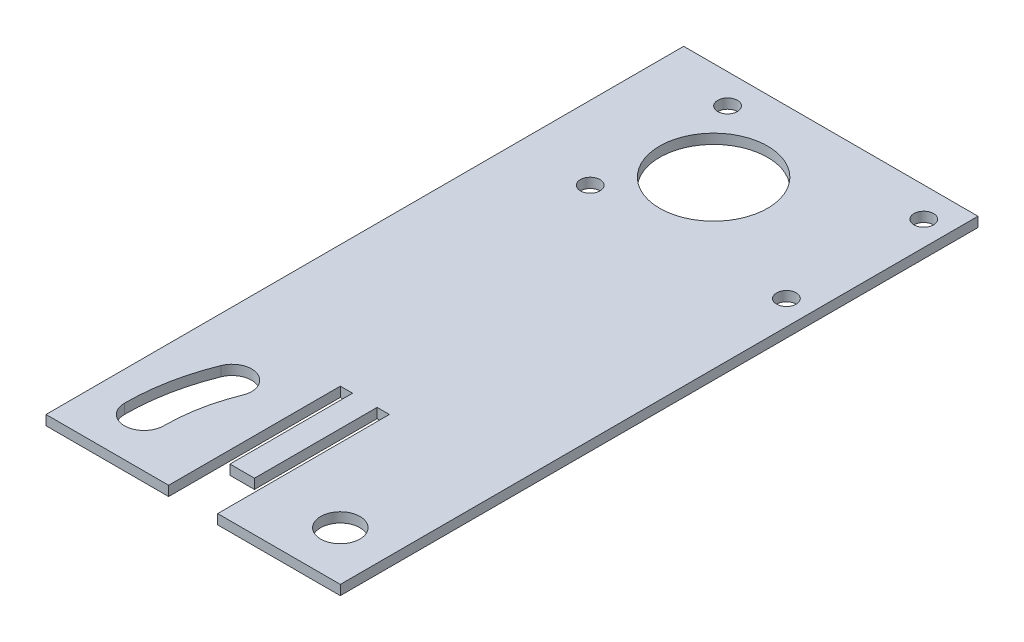
from build123d import *

# Parameters (mm, degrees)
BRIDA_START           = -2
BRIDA_BASE1_OUTLINE_R = 4
BRIDA_BASE1_DEPTH     = 2
CROQUIS6_R            = 2
CROQUIS6_R_2          = 11
CORTAR_EXTRUIR1_DEPTH = 10


# Read off the part's stored shape, not the designer's step: Brida base1
with BuildPart() as part:
    # Brida base1 outline → Brida base1 (new body)
    with BuildSketch(Plane(origin=(0, 0, 0), x_dir=(1, 0, 0), z_dir=(0, 1, 0)).offset(BRIDA_START)):
        Polygon((5, 35), (5, 0), (30, 0), (30, 130), (-30, 130), (-30, 0), (-5, 0), (-5, 35), (-2.5, 35), (-2.5, 10), (2.5, 10), (2.5, 35), align=None)
        with BuildLine():
            ThreePointArc((-24, 10), (-23.18981381, 18.404759548), (-20.789091679, 26.5))
            ThreePointArc((-20.789091679, 26.5), (-15.580992435, 28.708099244), (-13.372893192, 23.5))
            ThreePointArc((-13.372893192, 23.5), (-15.33712039, 16.876621448), (-16, 10))
            ThreePointArc((-16, 10), (-20, 6), (-24, 10))
        make_face(mode=Mode.SUBTRACT)
        with Locations((20, 10)):
            Circle(BRIDA_BASE1_OUTLINE_R, mode=Mode.SUBTRACT)
    extrude(amount=BRIDA_BASE1_DEPTH)

    # Croquis6 → Cortar-Extruir1 (cut)
    with BuildSketch(Plane(origin=(0, 0, 0), x_dir=(1, 0, 0), z_dir=(0, 1, 0))):
        with Locations(Location((25, 123.945, 0), (0, 0, 270))):
            Circle(CROQUIS6_R)
        with Locations(Location((25, 95.945, 0), (0, 0, 270))):
            Circle(CROQUIS6_R)
        with Locations(Location((-15, 123.945, 0), (0, 0, 270))):
            Circle(CROQUIS6_R)
        with Locations(Location((-15, 95.945, 0), (0, 0, 270))):
            Circle(CROQUIS6_R)
        with Locations(Location((-3.845, 109.945, 0), (0, 0, 270))):
            Circle(CROQUIS6_R_2)
    extrude(amount=-CORTAR_EXTRUIR1_DEPTH, mode=Mode.SUBTRACT)


solid = part.part
